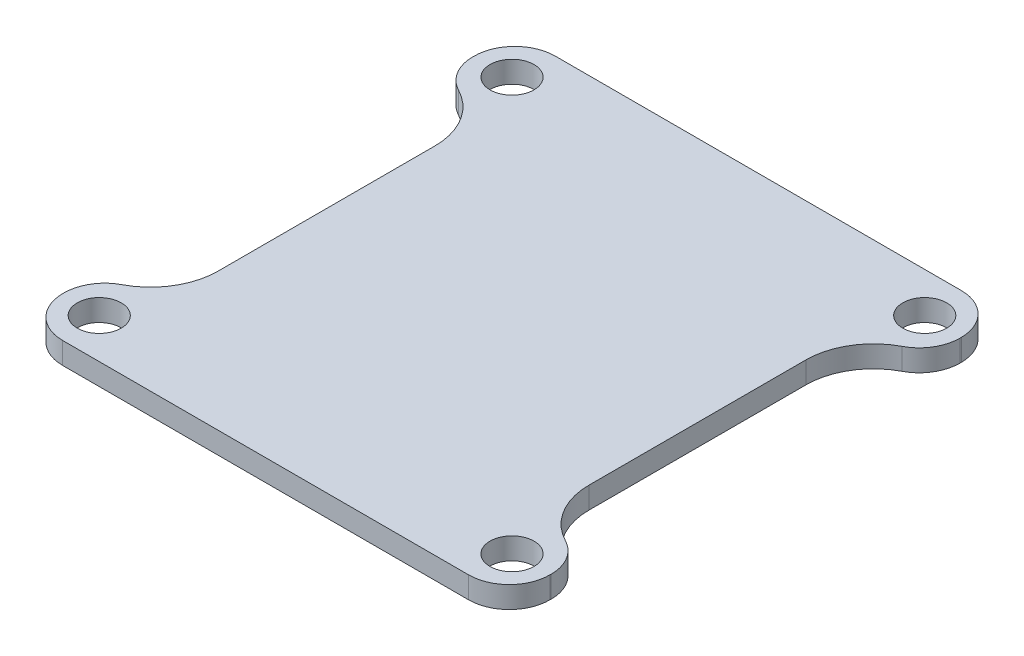
from build123d import *

# Parameters (mm, degrees)
SKETCH1_R           = 1.625
BOSS_EXTRUDE1_DEPTH = 1.6
FILLET1_R           = 3
FILLET2_R           = 5


with BuildPart() as part:
    # Sketch1 → Boss-Extrude1 (new body)
    with BuildSketch(Plane(origin=(0, 0, 0), x_dir=(1, 0, 0), z_dir=(0, 1, 0))):
        Polygon((-18, 18.2), (-18, 12.1), (-13.7, 12.1), (-13.7, -12.1), (-18, -12.1), (-18, -18.2), (18, -18.2), (18, -12.1), (13.7, -12.1), (13.7, 12.1), (18, 12.1), (18, 18.2), align=None)
        with Locations((-15.25, 15.25)):
            Circle(SKETCH1_R, mode=Mode.SUBTRACT)
        with Locations((15.25, 15.25)):
            Circle(SKETCH1_R, mode=Mode.SUBTRACT)
        with Locations((15.25, -15.25)):
            Circle(SKETCH1_R, mode=Mode.SUBTRACT)
        with Locations((-15.25, -15.25)):
            Circle(SKETCH1_R, mode=Mode.SUBTRACT)
    extrude(amount=BOSS_EXTRUDE1_DEPTH)

    # Fillet1
    fillet1_edges = [part.edges().sort_by_distance(p)[0] for p in [
        (-18, 0.8, 12.1),
        (-18, 0.8, -12.1),
        (18, 0.8, -12.1),
        (18, 0.8, 12.1),
        (18, 0.8, 18.2),
        (-18, 0.8, 18.2),
        (-18, 0.8, -18.2),
        (18, 0.8, -18.2),
    ]]
    fillet(fillet1_edges, radius=FILLET1_R)

    # Fillet2
    fillet2_edges = [part.edges().sort_by_distance(p)[0] for p in [
        (13.7, 0.8, -12.1),
        (13.7, 0.8, 12.1),
        (-13.7, 0.8, 12.1),
        (-13.7, 0.8, -12.1),
    ]]
    fillet(fillet2_edges, radius=FILLET2_R)


solid = part.part
